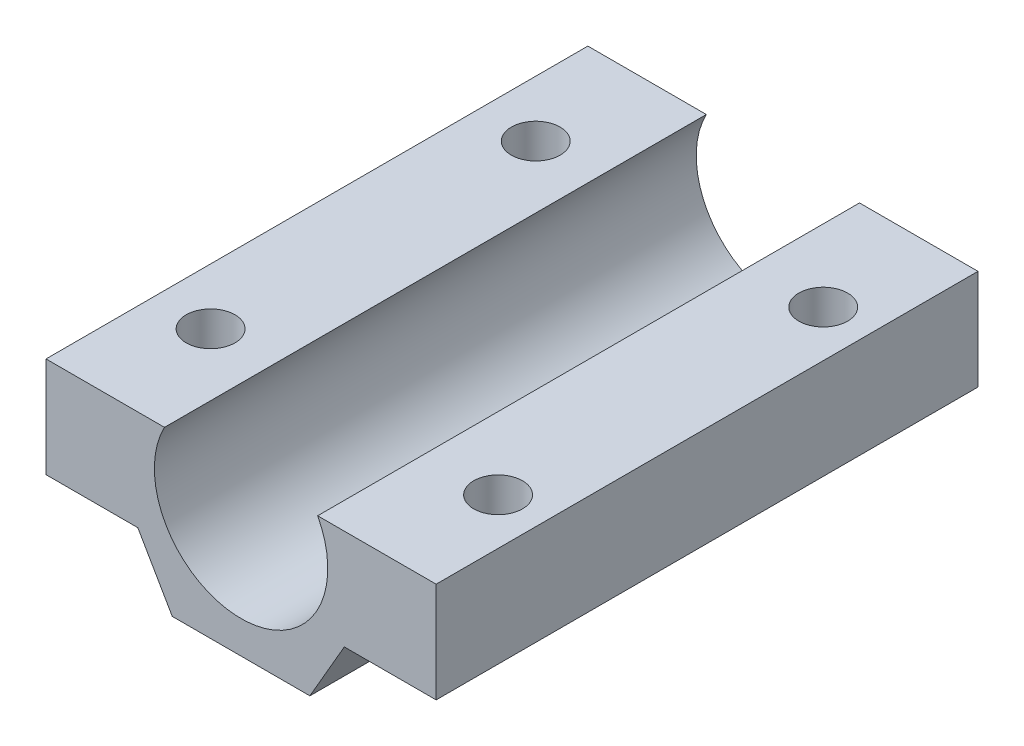
from build123d import *

# Parameters (mm, degrees)
IZIM1_W                     = 36
IZIM1_H                     = 36
IZIM1_R                     = 8
Y_KSEKLIK_EKSTR_ZYON1_DEPTH = 50
IZIM2_W                     = 36
IZIM2_H                     = 5
KES_EKSTR_ZYON1_DEPTH       = 50
IZIM3_W                     = 36
IZIM3_H                     = 3
KES_EKSTR_ZYON2_DEPTH       = 50
KES_EKSTR_ZYON3_DEPTH       = 50
M4_BO_LUKLU_DELIK1_D        = 4.5
KES_EKSTR_ZYON5_START       = -50
KES_EKSTR_ZYON5_DEPTH       = 50


# Read off the part's stored shape, not the designer's step: Kes-Ekstrüzyon5
with BuildPart() as part:
    # Çizim1 → Yükseklik-Ekstrüzyon1 (new body)
    with BuildSketch(Plane.XY):
        Rectangle(IZIM1_W, IZIM1_H)
        Circle(IZIM1_R, mode=Mode.SUBTRACT)
    extrude(amount=Y_KSEKLIK_EKSTR_ZYON1_DEPTH)

    # Çizim2 → Kes-Ekstrüzyon1 (cut)
    with BuildSketch(Plane.XY.offset(50)):
        with Locations((0, 15.5)):
            Rectangle(IZIM2_W, IZIM2_H)
    extrude(amount=-KES_EKSTR_ZYON1_DEPTH, mode=Mode.SUBTRACT)

    # Çizim3 → Kes-Ekstrüzyon2 (cut)
    with BuildSketch(Plane.XY.offset(50)):
        with Locations((0, -16.5)):
            Rectangle(IZIM3_W, IZIM3_H)
    extrude(amount=-KES_EKSTR_ZYON2_DEPTH, mode=Mode.SUBTRACT)

    # Çizim4 → Kes-Ekstrüzyon3 (cut)
    with BuildSketch(Plane.XY.offset(50)):
        Polygon((-6.350852961, -11), (-9.526279442, -5.5), (-18, -5.5), (-18, -15), (18, -15), (18, -5.5), (9.526279442, -5.5), (6.350852961, -11), align=None)
    extrude(amount=-KES_EKSTR_ZYON3_DEPTH, mode=Mode.SUBTRACT)

    # M4 Boşluklu Delik1 (through all)
    with Locations(Plane(origin=(0, -5.5, 0), x_dir=(-1, 0, 0), z_dir=(0, -1, 0))):
        with Locations((-13.718329125, -40), (-13.718329125, -10), (12.810498521, -10), (12.810498521, -40)):
            Hole(M4_BO_LUKLU_DELIK1_D / 2)

    # Kes-Ekstrüzyon5 outline → Kes-Ekstrüzyon5 (cut)
    with BuildSketch(Plane.XY.offset(50).offset(KES_EKSTR_ZYON5_START)):
        with BuildLine():
            Line((7.066647013, 3.75), (18, 3.75))
            Line((18, 3.75), (18, 13))
            Line((18, 13), (-18, 13))
            Line((-18, 13), (-18, 3.75))
            Line((-18, 3.75), (-7.066647013, 3.75))
            ThreePointArc((-7.066647013, 3.75), (0, 8), (7.066647013, 3.75))
        make_face()
    extrude(amount=KES_EKSTR_ZYON5_DEPTH, mode=Mode.SUBTRACT)


solid = part.part
